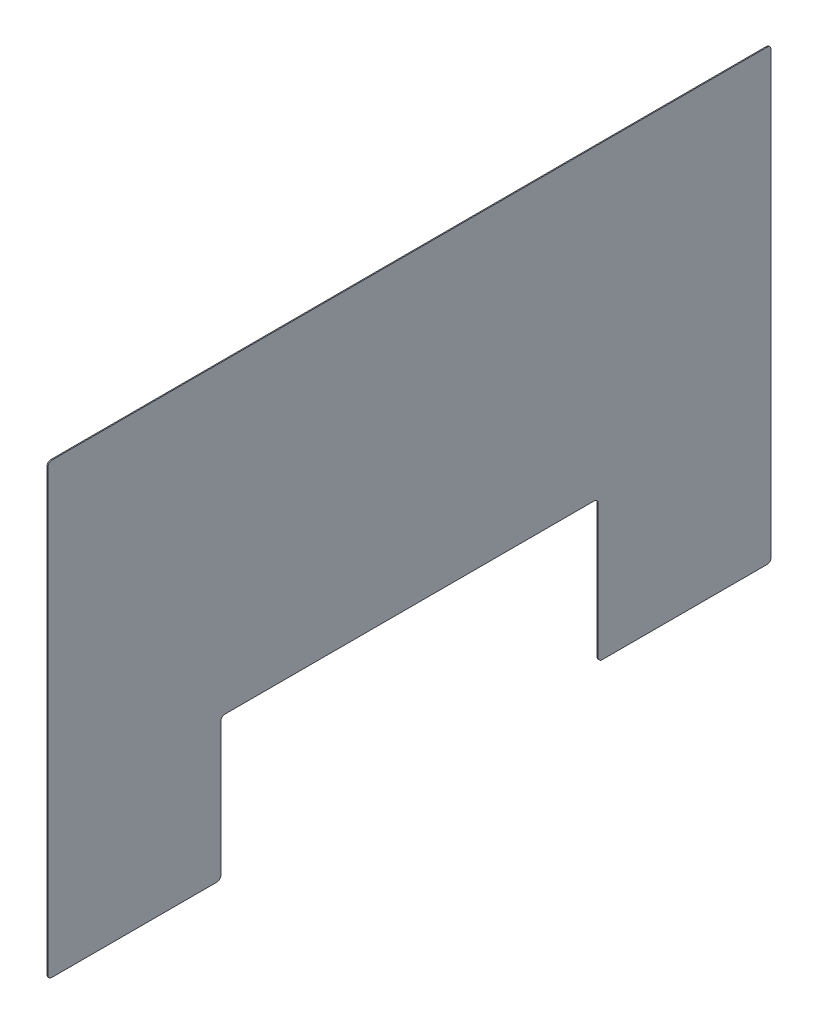
from build123d import *

# Parameters (mm, degrees)
BOSS_EXTRUDE1_DEPTH = 1.5875
FILLET1_R           = 6.35


with BuildPart() as part:
    # Sketch1 → Boss-Extrude1 (new body)
    with BuildSketch(Plane(origin=(0, 0, 0), x_dir=(0, 0, -1), z_dir=(1, 0, 0))):
        Polygon((-304.8, -361.95), (-584.2, -361.95), (-584.2, 361.95), (584.2, 361.95), (584.2, -361.95), (304.8, -361.95), (304.8, -133.35), (-304.8, -133.35), align=None)
    extrude(amount=BOSS_EXTRUDE1_DEPTH)

    # Fillet1
    fillet1_edges = [part.edges().sort_by_distance(p)[0] for p in [
        (0.79375, 361.95, -584.2),
        (0.79375, -361.95, -584.2),
        (0.79375, -361.95, -304.8),
        (0.79375, -133.35, -304.8),
        (0.79375, -133.35, 304.8),
        (0.79375, -361.95, 304.8),
        (0.79375, -361.95, 584.2),
        (0.79375, 361.95, 584.2),
    ]]
    fillet(fillet1_edges, radius=FILLET1_R)


solid = part.part
